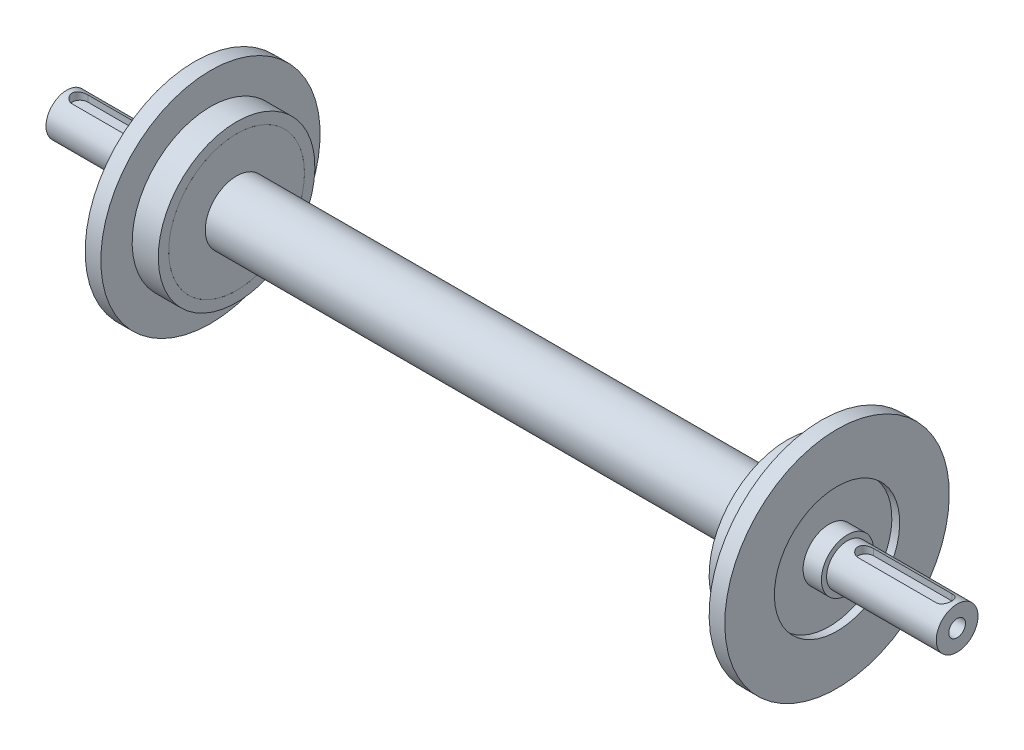
from build123d import *

# Parameters (mm, degrees)
SKICA2_W                 = 8
SKICA2_H                 = 8
ODEBRAT_VYSUNUT_M1_DEPTH = 1.5


with BuildPart() as part:
    # Skica1 → Rotovat1 (revolve)
    with BuildSketch(Plane.XY):
        Polygon((-32.5, 5), (-21, 5), (-21, 4), (0, 4), (0, 1.6), (-12, 1.6), (-12.923760431, 0), (-157.576239569, 0), (-158.5, 1.6), (-170.5, 1.6), (-170.5, 4), (-149.5, 4), (-149.5, 5), (-138, 5), (-138, 6), (-32.5, 6), align=None)
    revolve(axis=Axis((-12.923760431, 0, 0), (-1, 0, 0)))

    # Skica4 → Odebrat vysunutím1 (cut)
    with BuildSketch(Plane(origin=(0, 4, 0), x_dir=(1, 0, 0), z_dir=(0, 1, 0))):
        with BuildLine():
            Line((-17.5, -1.5), (-2.5, -1.5))
            ThreePointArc((-2.5, -1.5), (-1, 0), (-2.5, 1.5))
            Line((-2.5, 1.5), (-17.5, 1.5))
            ThreePointArc((-17.5, 1.5), (-19, 0), (-17.5, -1.5))
        make_face()
        with BuildLine():
            Line((-168, 1.5), (-153, 1.5))
            ThreePointArc((-153, 1.5), (-151.5, 0), (-153, -1.5))
            Line((-153, -1.5), (-168, -1.5))
            ThreePointArc((-168, -1.5), (-169.5, 0), (-168, 1.5))
        make_face()
    extrude(amount=-ODEBRAT_VYSUNUT_M1_DEPTH, mode=Mode.SUBTRACT)


with BuildPart() as body_2:
    # Skica2 → Rotovat2 (revolve)
    with BuildSketch(Plane.XY):
        with Locations((-142, 9)):
            Rectangle(SKICA2_W, SKICA2_H)
        with Locations((-28.5, 9)):
            Rectangle(SKICA2_W, SKICA2_H)
    revolve(axis=Axis((0, 0, 0), (-1, 0, 0)))


with BuildPart() as body_3:
    # Skica3 → Rotovat3 (revolve)
    with BuildSketch(Plane.XY):
        Polygon((-147.5, 15), (-147.5, 12), (-146, 12), (-146, 13), (-138, 13), (-138, 15), (-143, 15), (-143, 21), (-146, 21), (-146, 15), align=None)
        Polygon((-24.5, 13), (-24.5, 12), (-23, 12), (-23, 21.5), (-26, 21.5), (-26, 15), (-32.5, 15), (-32.5, 13), align=None)
    revolve(axis=Axis((0, 0, 0), (-1, 0, 0)))


solid = Compound([part.part, body_2.part, body_3.part])
